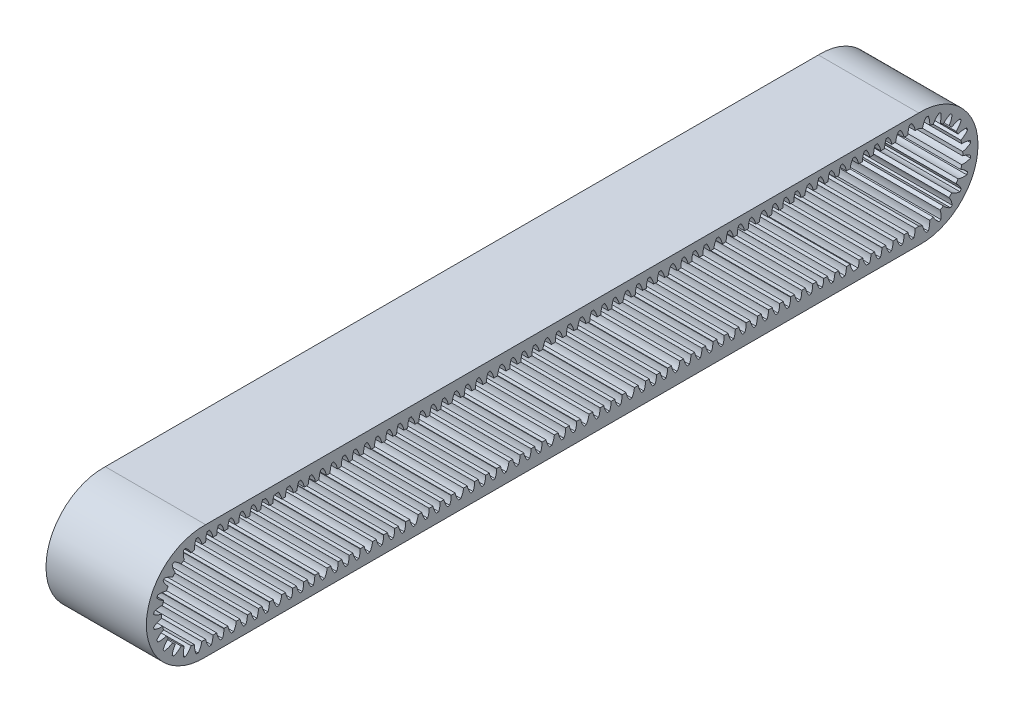
from build123d import *

# Parameters (mm, degrees)
BOSS_EXTRUDE1_DEPTH = 28


with BuildPart() as part:
    # Sketch1 → Boss-Extrude1 (new body)
    with BuildSketch(Plane(origin=(-24.036200878, 0, 0), x_dir=(0, 0, -1), z_dir=(1, 0, 0))):
        with BuildLine():
            Line((112.0321418, 33.774122943), (-86.910919226, 33.774122943))
            ThreePointArc((-86.910919226, 33.774122943), (-103.439388713, 17.782852825), (-86.910919226, 1.791582706))
            Line((-86.910919226, 1.791582706), (112.0321418, 1.791582706))
            ThreePointArc((112.0321418, 1.791582706), (128.560611287, 17.782852825), (112.0321418, 33.774122943))
        make_face()
        with BuildLine():
            Line((-87.949109181, 6.091165602), (-87.9678582, 6.044743096))
            ThreePointArc((-87.9678582, 6.044743096), (-88.331447478, 4.866089704), (-88.977199836, 3.815173496))
            ThreePointArc((-88.977199836, 3.815173496), (-89.273553099, 3.850991145), (-89.56907866, 3.893095822))
            ThreePointArc((-89.56907866, 3.893095822), (-89.92083041, 5.075335936), (-89.966972738, 6.307931518))
            ThreePointArc((-89.966972738, 6.307931518), (-90.480512493, 6.433224366), (-90.98789739, 6.581487454))
            ThreePointArc((-90.98789739, 6.581487454), (-91.64415561, 5.537099532), (-92.539901618, 4.689125434))
            ThreePointArc((-92.539901618, 4.689125434), (-92.8168866, 4.800424495), (-93.091444879, 4.917582133))
            ThreePointArc((-93.091444879, 4.917582133), (-93.125224721, 6.150578445), (-92.850775577, 7.353116864))
            ThreePointArc((-92.850775577, 7.353116864), (-93.314388713, 7.60705433), (-93.766111578, 7.881586351))
            ThreePointArc((-93.766111578, 7.881586351), (-94.670315826, 7.04263721), (-95.755011875, 6.455393256))
            ThreePointArc((-95.755011875, 6.455393256), (-95.993752506, 6.634588881), (-96.228632811, 6.818815381))
            ThreePointArc((-96.228632811, 6.818815381), (-95.942138705, 8.018541229), (-95.365801343, 9.109071479))
            ThreePointArc((-95.365801343, 9.109071479), (-95.747893392, 9.474348146), (-96.113170058, 9.856440195))
            ThreePointArc((-96.113170058, 9.856440195), (-97.203700309, 9.280102833), (-98.403426156, 8.993608727))
            ThreePointArc((-98.403426156, 8.993608727), (-98.587652657, 9.228489031), (-98.766848282, 9.467229662))
            ThreePointArc((-98.766848282, 9.467229662), (-98.179604328, 10.551925712), (-97.340655187, 11.456129959))
            ThreePointArc((-97.340655187, 11.456129959), (-97.615187208, 11.907852825), (-97.869124674, 12.371465961))
            ThreePointArc((-97.869124674, 12.371465961), (-99.059184076, 12.077032677), (-100.285089249, 12.086458648))
            ThreePointArc((-100.285089249, 12.086458648), (-100.412524375, 12.382975052), (-100.533116103, 12.682339919))
            ThreePointArc((-100.533116103, 12.682339919), (-99.685142006, 13.578085928), (-98.640754084, 14.234344147))
            ThreePointArc((-98.640754084, 14.234344147), (-98.789017172, 14.741729045), (-98.91431002, 15.255268799))
            ThreePointArc((-98.91431002, 15.255268799), (-100.146905601, 15.301411127), (-101.329145716, 15.653162878))
            ThreePointArc((-101.329145716, 15.653162878), (-101.371250393, 15.948688438), (-101.407068041, 16.245041702))
            ThreePointArc((-101.407068041, 16.245041702), (-100.356151834, 16.89079406), (-99.177498442, 17.254383337))
            ThreePointArc((-99.177498442, 17.254383337), (-99.189388713, 17.782852825), (-99.177498442, 18.311322312))
            ThreePointArc((-99.177498442, 18.311322312), (-100.356151834, 18.67491159), (-101.407068041, 19.320663947))
            ThreePointArc((-101.407068041, 19.320663947), (-101.371250393, 19.617017211), (-101.329145716, 19.912542771))
            ThreePointArc((-101.329145716, 19.912542771), (-100.146905601, 20.264294522), (-98.91431002, 20.31043685))
            ThreePointArc((-98.91431002, 20.31043685), (-98.789017172, 20.823976604), (-98.640754084, 21.331361502))
            ThreePointArc((-98.640754084, 21.331361502), (-99.685142006, 21.987619721), (-100.533116103, 22.88336573))
            ThreePointArc((-100.533116103, 22.88336573), (-100.421817043, 23.160350711), (-100.304659404, 23.43490899))
            ThreePointArc((-100.304659404, 23.43490899), (-99.071663093, 23.468688833), (-97.869124674, 23.194239688))
            ThreePointArc((-97.869124674, 23.194239688), (-97.615187208, 23.657852825), (-97.340655187, 24.10957569))
            ThreePointArc((-97.340655187, 24.10957569), (-98.179604328, 25.013779937), (-98.766848282, 26.098475987))
            ThreePointArc((-98.766848282, 26.098475987), (-98.587652657, 26.337216618), (-98.403426156, 26.572096922))
            ThreePointArc((-98.403426156, 26.572096922), (-97.203700309, 26.285602816), (-96.113170058, 25.709265454))
            ThreePointArc((-96.113170058, 25.709265454), (-95.747893392, 26.091357503), (-95.365801343, 26.45663417))
            ThreePointArc((-95.365801343, 26.45663417), (-95.942138705, 27.54716442), (-96.228632811, 28.746890268))
            ThreePointArc((-96.228632811, 28.746890268), (-95.993752506, 28.931116768), (-95.755011875, 29.110312393))
            ThreePointArc((-95.755011875, 29.110312393), (-94.670315826, 28.523068439), (-93.766111578, 27.684119298))
            ThreePointArc((-93.766111578, 27.684119298), (-93.314388713, 27.958651319), (-92.850775577, 28.212588785))
            ThreePointArc((-92.850775577, 28.212588785), (-93.125224721, 29.415127204), (-93.091444879, 30.648123516))
            ThreePointArc((-93.091444879, 30.648123516), (-92.8168866, 30.765281154), (-92.539901618, 30.876580215))
            ThreePointArc((-92.539901618, 30.876580215), (-91.64415561, 30.028606117), (-90.98789739, 28.984218195))
            ThreePointArc((-90.98789739, 28.984218195), (-90.480512493, 29.132481283), (-89.966972738, 29.257774131))
            ThreePointArc((-89.966972738, 29.257774131), (-89.92083041, 30.490369713), (-89.56907866, 31.672609827))
            ThreePointArc((-89.56907866, 31.672609827), (-89.273553099, 31.714714504), (-88.977199836, 31.750532153))
            ThreePointArc((-88.977199836, 31.750532153), (-88.331447478, 30.699615945), (-87.9678582, 29.520962553))
            ThreePointArc((-87.9678582, 29.520962553), (-87.439388713, 29.532852825), (-86.910919226, 29.520962553))
            Line((-86.910919226, 29.520962553), (-86.876378041, 29.692733051))
            ThreePointArc((-86.876378041, 29.692733051), (-86.790815157, 30.791942854), (-86.462244664, 31.844380325))
            ThreePointArc((-86.462244664, 31.844380325), (-86.166719103, 31.886485002), (-85.870365839, 31.92230265))
            ThreePointArc((-85.870365839, 31.92230265), (-85.224613482, 30.871386443), (-84.861024204, 29.692733051))
            ThreePointArc((-84.861024204, 29.692733051), (-84.334939006, 29.70462308), (-83.808849026, 29.692946556))
            ThreePointArc((-83.808849026, 29.692946556), (-83.718252314, 30.771866452), (-83.393490616, 31.80472934))
            ThreePointArc((-83.393490616, 31.80472934), (-83.097965055, 31.846834018), (-82.801611791, 31.882651666))
            ThreePointArc((-82.801611791, 31.882651666), (-82.155859434, 30.831735458), (-81.792270156, 29.653082066))
            ThreePointArc((-81.792270156, 29.653082066), (-81.263800669, 29.664972338), (-80.735331182, 29.653082066))
            Line((-80.735331182, 29.653082066), (-80.692065816, 29.634588536))
            ThreePointArc((-80.692065816, 29.634588536), (-80.606502932, 30.733798339), (-80.277932439, 31.78623581))
            ThreePointArc((-80.277932439, 31.78623581), (-79.982406879, 31.828340487), (-79.686053615, 31.864158136))
            ThreePointArc((-79.686053615, 31.864158136), (-79.040301257, 30.813241928), (-78.676711979, 29.634588536))
            ThreePointArc((-78.676711979, 29.634588536), (-78.148242492, 29.646478808), (-77.619773005, 29.634588536))
            Line((-77.619773005, 29.634588536), (-77.610895308, 29.679121052))
            ThreePointArc((-77.610895308, 29.679121052), (-77.525332424, 30.778330855), (-77.196761931, 31.830768326))
            ThreePointArc((-77.196761931, 31.830768326), (-76.90123637, 31.872873003), (-76.604883106, 31.908690651))
            ThreePointArc((-76.604883106, 31.908690651), (-75.959130749, 30.857774444), (-75.595541471, 29.679121052))
            ThreePointArc((-75.595541471, 29.679121052), (-75.067071984, 29.691011323), (-74.538602497, 29.679121052))
            Line((-74.538602497, 29.679121052), (-74.495329565, 29.705622917))
            ThreePointArc((-74.495329565, 29.705622917), (-74.409766681, 30.804832721), (-74.081196188, 31.857270191))
            ThreePointArc((-74.081196188, 31.857270191), (-73.785670628, 31.899374869), (-73.489317364, 31.935192517))
            ThreePointArc((-73.489317364, 31.935192517), (-72.843565006, 30.88427631), (-72.479975728, 29.705622917))
            ThreePointArc((-72.479975728, 29.705622917), (-71.96239113, 29.717508147), (-71.444785399, 29.706581891))
            ThreePointArc((-71.444785399, 29.706581891), (-71.355398935, 30.790473298), (-71.029697081, 31.828128744))
            Line((-71.029697081, 31.828128744), (-70.185469376, 31.754337378))
            ThreePointArc((-70.185469376, 31.754337378), (-69.539717018, 30.70342117), (-69.17612774, 29.524767778))
            ThreePointArc((-69.17612774, 29.524767778), (-68.665859283, 29.536643953), (-68.155556482, 29.526348669))
            ThreePointArc((-68.155556482, 29.526348669), (-68.085556233, 30.423267763), (-67.853149848, 31.292377174))
            ThreePointArc((-67.853149848, 31.292377174), (-67.24472064, 31.398313694), (-66.632204399, 31.47725988))
            ThreePointArc((-66.632204399, 31.47725988), (-66.025631381, 30.457420414), (-65.681311431, 29.321882156))
            ThreePointArc((-65.681311431, 29.321882156), (-65.152841944, 29.333772428), (-64.624372457, 29.321882156))
            Line((-64.624372457, 29.321882156), (-64.623645867, 29.322608746))
            ThreePointArc((-64.623645867, 29.322608746), (-64.526912338, 30.356089131), (-64.215171005, 31.346168131))
            ThreePointArc((-64.215171005, 31.346168131), (-63.832714605, 31.4043435), (-63.448801714, 31.451968745))
            ThreePointArc((-63.448801714, 31.451968745), (-62.803049357, 30.401052538), (-62.439460079, 29.222399145))
            ThreePointArc((-62.439460079, 29.222399145), (-61.911473801, 29.234289407), (-61.383486547, 29.222442571))
            ThreePointArc((-61.383486547, 29.222442571), (-61.277926134, 30.233819879), (-60.96638275, 31.201790838))
            ThreePointArc((-60.96638275, 31.201790838), (-60.670857189, 31.243895516), (-60.374503925, 31.279713164))
            ThreePointArc((-60.374503925, 31.279713164), (-59.728751568, 30.228796957), (-59.36516229, 29.050143564))
            ThreePointArc((-59.36516229, 29.050143564), (-58.836692803, 29.062033836), (-58.308223316, 29.050143564))
            Line((-58.308223316, 29.050143564), (-58.292562735, 29.065804145))
            ThreePointArc((-58.292562735, 29.065804145), (-58.17883617, 30.033824792), (-57.876217037, 30.960334028))
            ThreePointArc((-57.876217037, 30.960334028), (-57.580691476, 31.002438705), (-57.284338213, 31.038256353))
            ThreePointArc((-57.284338213, 31.038256353), (-56.638585855, 29.987340146), (-56.274996577, 28.808686754))
            ThreePointArc((-56.274996577, 28.808686754), (-55.74652709, 28.820577025), (-55.218057603, 28.808686754))
            Line((-55.218057603, 28.808686754), (-55.227747269, 28.820877099))
            ThreePointArc((-55.227747269, 28.820877099), (-55.142184385, 29.920086902), (-54.813613892, 30.972524373))
            ThreePointArc((-54.813613892, 30.972524373), (-54.518088332, 31.01462905), (-54.221735068, 31.050446699))
            ThreePointArc((-54.221735068, 31.050446699), (-53.575982711, 29.999530491), (-53.212393433, 28.820877099))
            ThreePointArc((-53.212393433, 28.820877099), (-52.683923946, 28.83276737), (-52.155454458, 28.820877099))
            Line((-52.155454458, 28.820877099), (-52.163782419, 28.858116727))
            ThreePointArc((-52.163782419, 28.858116727), (-52.078219536, 29.95732653), (-51.749649042, 31.009764001))
            ThreePointArc((-51.749649042, 31.009764001), (-51.454123482, 31.051868678), (-51.157770218, 31.087686327))
            ThreePointArc((-51.157770218, 31.087686327), (-50.512017861, 30.036770119), (-50.148428583, 28.858116727))
            ThreePointArc((-50.148428583, 28.858116727), (-49.619959096, 28.870006998), (-49.091489609, 28.858116727))
            Line((-49.091489609, 28.858116727), (-49.042850018, 28.946552333))
            ThreePointArc((-49.042850018, 28.946552333), (-48.957287134, 30.045762136), (-48.628716641, 31.098199607))
            ThreePointArc((-48.628716641, 31.098199607), (-48.33319108, 31.140304284), (-48.036837816, 31.176121933))
            ThreePointArc((-48.036837816, 31.176121933), (-47.391085459, 30.125205725), (-47.027496181, 28.946552333))
            ThreePointArc((-47.027496181, 28.946552333), (-46.501410983, 28.958442363), (-45.975321003, 28.946765839))
            ThreePointArc((-45.975321003, 28.946765839), (-45.884724291, 30.025685735), (-45.559962593, 31.058548623))
            ThreePointArc((-45.559962593, 31.058548623), (-45.264437032, 31.1006533), (-44.968083769, 31.136470948))
            ThreePointArc((-44.968083769, 31.136470948), (-44.322331411, 30.085554741), (-43.958742133, 28.906901349))
            ThreePointArc((-43.958742133, 28.906901349), (-43.430272646, 28.91879162), (-42.901803159, 28.906901349))
            Line((-42.901803159, 28.906901349), (-42.858537793, 28.888407819))
            ThreePointArc((-42.858537793, 28.888407819), (-42.77297491, 29.987617622), (-42.444404416, 31.040055093))
            ThreePointArc((-42.444404416, 31.040055093), (-42.148878856, 31.08215977), (-41.852525592, 31.117977418))
            ThreePointArc((-41.852525592, 31.117977418), (-41.206773235, 30.067061211), (-40.843183957, 28.888407819))
            ThreePointArc((-40.843183957, 28.888407819), (-40.31471447, 28.90029809), (-39.786244983, 28.888407819))
            Line((-39.786244983, 28.888407819), (-39.777367285, 28.932940334))
            ThreePointArc((-39.777367285, 28.932940334), (-39.691804401, 30.032150137), (-39.363233908, 31.084587608))
            ThreePointArc((-39.363233908, 31.084587608), (-39.067708347, 31.126692285), (-38.771355083, 31.162509934))
            ThreePointArc((-38.771355083, 31.162509934), (-38.125602726, 30.111593726), (-37.762013448, 28.932940334))
            ThreePointArc((-37.762013448, 28.932940334), (-37.233543961, 28.944830605), (-36.705074474, 28.932940334))
            Line((-36.705074474, 28.932940334), (-36.661801542, 28.9594422))
            ThreePointArc((-36.661801542, 28.9594422), (-36.576238659, 30.058652003), (-36.247668165, 31.111089474))
            ThreePointArc((-36.247668165, 31.111089474), (-35.952142605, 31.153194151), (-35.655789341, 31.189011799))
            ThreePointArc((-35.655789341, 31.189011799), (-35.010036984, 30.138095592), (-34.646447706, 28.9594422))
            ThreePointArc((-34.646447706, 28.9594422), (-34.128863107, 28.97132743), (-33.611257376, 28.960401173))
            ThreePointArc((-33.611257376, 28.960401173), (-33.521870912, 30.04429258), (-33.196169059, 31.081948026))
            ThreePointArc((-33.196169059, 31.081948026), (-32.900643498, 31.124052704), (-32.604290234, 31.159870352))
            ThreePointArc((-32.604290234, 31.159870352), (-31.958537877, 30.108954144), (-31.594948599, 28.930300752))
            ThreePointArc((-31.594948599, 28.930300752), (-31.066479112, 28.942191024), (-30.538009625, 28.930300752))
            Line((-30.538009625, 28.930300752), (-30.528051724, 28.935766688))
            ThreePointArc((-30.528051724, 28.935766688), (-30.442488841, 30.034976491), (-30.113918347, 31.087413962))
            ThreePointArc((-30.113918347, 31.087413962), (-29.818392787, 31.129518639), (-29.522039523, 31.165336287))
            Line((-29.522039523, 31.165336287), (-29.487212006, 31.048087044))
            ThreePointArc((-29.487212006, 31.048087044), (-28.841459649, 29.997170837), (-28.477870371, 28.818517444))
            ThreePointArc((-28.477870371, 28.818517444), (-27.949400884, 28.830407716), (-27.420931397, 28.818517444))
            Line((-27.420931397, 28.818517444), (-27.369310081, 28.883335483))
            ThreePointArc((-27.369310081, 28.883335483), (-27.283747197, 29.982545287), (-26.955176704, 31.034982758))
            ThreePointArc((-26.955176704, 31.034982758), (-26.659651144, 31.077087435), (-26.36329788, 31.112905083))
            ThreePointArc((-26.36329788, 31.112905083), (-25.717545522, 30.061988876), (-25.353956244, 28.883335483))
            ThreePointArc((-25.353956244, 28.883335483), (-24.825486757, 28.895225755), (-24.29701727, 28.883335483))
            Line((-24.29701727, 28.883335483), (-24.295310914, 28.881424942))
            ThreePointArc((-24.295310914, 28.881424942), (-24.20974803, 29.980634745), (-23.881177537, 31.033072216))
            ThreePointArc((-23.881177537, 31.033072216), (-23.585651976, 31.075176893), (-23.289298712, 31.110994542))
            ThreePointArc((-23.289298712, 31.110994542), (-22.643546355, 30.060078334), (-22.279957077, 28.881424942))
            ThreePointArc((-22.279957077, 28.881424942), (-21.75148759, 28.893315213), (-21.223018103, 28.881424942))
            Line((-21.223018103, 28.881424942), (-21.214586574, 28.891167214))
            ThreePointArc((-21.214586574, 28.891167214), (-21.12902369, 29.990377017), (-20.800453197, 31.042814488))
            ThreePointArc((-20.800453197, 31.042814488), (-20.504927636, 31.084919165), (-20.208574372, 31.120736813))
            ThreePointArc((-20.208574372, 31.120736813), (-19.562822015, 30.069820606), (-19.199232737, 28.891167214))
            ThreePointArc((-19.199232737, 28.891167214), (-18.67076325, 28.903057485), (-18.142293763, 28.891167214))
            Line((-18.142293763, 28.891167214), (-18.147642105, 28.893455373))
            ThreePointArc((-18.147642105, 28.893455373), (-17.90226074, 30.01294439), (-17.404147292, 31.045102647))
            ThreePointArc((-17.404147292, 31.045102647), (-17.108621731, 31.087207324), (-16.812268467, 31.123024973))
            ThreePointArc((-16.812268467, 31.123024973), (-16.16651611, 30.072108765), (-15.802926832, 28.893455373))
            ThreePointArc((-15.802926832, 28.893455373), (-15.274457345, 28.905345644), (-14.745987858, 28.893455373))
            Line((-14.745987858, 28.893455373), (-14.694366542, 28.958273412))
            ThreePointArc((-14.694366542, 28.958273412), (-14.608803658, 30.057483215), (-14.280233165, 31.109920686))
            ThreePointArc((-14.280233165, 31.109920686), (-13.984707605, 31.152025363), (-13.688354341, 31.187843012))
            ThreePointArc((-13.688354341, 31.187843012), (-13.042601983, 30.136926804), (-12.679012706, 28.958273412))
            ThreePointArc((-12.679012706, 28.958273412), (-12.150543218, 28.970163683), (-11.622073731, 28.958273412))
            Line((-11.622073731, 28.958273412), (-11.620367375, 28.956362871))
            ThreePointArc((-11.620367375, 28.956362871), (-11.534804491, 30.055572674), (-11.206233998, 31.108010145))
            ThreePointArc((-11.206233998, 31.108010145), (-10.910708437, 31.150114822), (-10.614355173, 31.18593247))
            ThreePointArc((-10.614355173, 31.18593247), (-9.968602816, 30.135016263), (-9.605013538, 28.956362871))
            ThreePointArc((-9.605013538, 28.956362871), (-9.076544051, 28.968253142), (-8.548074564, 28.956362871))
            Line((-8.548074564, 28.956362871), (-8.545871857, 28.996265589))
            ThreePointArc((-8.545871857, 28.996265589), (-8.460308973, 30.095475393), (-8.13173848, 31.147912863))
            ThreePointArc((-8.13173848, 31.147912863), (-7.83621292, 31.190017541), (-7.539859656, 31.225835189))
            ThreePointArc((-7.539859656, 31.225835189), (-6.894107298, 30.174918982), (-6.53051802, 28.996265589))
            ThreePointArc((-6.53051802, 28.996265589), (-6.002048533, 29.008155861), (-5.473579046, 28.996265589))
            Line((-5.473579046, 28.996265589), (-5.478927389, 28.998553748))
            ThreePointArc((-5.478927389, 28.998553748), (-5.233546024, 30.118042766), (-4.735432575, 31.150201022))
            ThreePointArc((-4.735432575, 31.150201022), (-4.439907015, 31.1923057), (-4.143553751, 31.228123348))
            ThreePointArc((-4.143553751, 31.228123348), (-3.497801394, 30.177207141), (-3.134212116, 28.998553748))
            ThreePointArc((-3.134212116, 28.998553748), (-2.605742629, 29.01044402), (-2.077273142, 28.998553748))
            Line((-2.077273142, 28.998553748), (-2.025651826, 29.063371787))
            ThreePointArc((-2.025651826, 29.063371787), (-1.940088942, 30.162581591), (-1.611518449, 31.215019061))
            ThreePointArc((-1.611518449, 31.215019061), (-1.315992888, 31.257123739), (-1.019639625, 31.292941387))
            ThreePointArc((-1.019639625, 31.292941387), (-0.373887267, 30.24202518), (-0.010297989, 29.063371787))
            ThreePointArc((-0.010297989, 29.063371787), (0.518171498, 29.075262059), (1.046640985, 29.063371787))
            Line((1.046640985, 29.063371787), (1.048347342, 29.061461246))
            ThreePointArc((1.048347342, 29.061461246), (1.133910226, 30.160671049), (1.462480719, 31.21310852))
            ThreePointArc((1.462480719, 31.21310852), (1.758006279, 31.255213197), (2.054359543, 31.291030846))
            ThreePointArc((2.054359543, 31.291030846), (2.700111901, 30.240114638), (3.063701179, 29.061461246))
            ThreePointArc((3.063701179, 29.061461246), (3.592170666, 29.073351517), (4.120640153, 29.061461246))
            Line((4.120640153, 29.061461246), (4.129071682, 29.071203518))
            ThreePointArc((4.129071682, 29.071203518), (4.214634566, 30.170413321), (4.543205059, 31.222850792))
            ThreePointArc((4.543205059, 31.222850792), (4.838730619, 31.264955469), (5.135083883, 31.300773117))
            ThreePointArc((5.135083883, 31.300773117), (5.780836241, 30.24985691), (6.144425519, 29.071203518))
            ThreePointArc((6.144425519, 29.071203518), (6.672895006, 29.083093789), (7.201364493, 29.071203518))
            Line((7.201364493, 29.071203518), (7.19601615, 29.073491677))
            ThreePointArc((7.19601615, 29.073491677), (7.441397515, 30.192980694), (7.939510964, 31.225138951))
            ThreePointArc((7.939510964, 31.225138951), (8.235036524, 31.267243628), (8.531389788, 31.303061277))
            ThreePointArc((8.531389788, 31.303061277), (9.177142145, 30.252145069), (9.540731423, 29.073491677))
            ThreePointArc((9.540731423, 29.073491677), (10.06920091, 29.085381948), (10.597670397, 29.073491677))
            Line((10.597670397, 29.073491677), (10.649291713, 29.138309716))
            ThreePointArc((10.649291713, 29.138309716), (10.734854597, 30.237519519), (11.06342509, 31.28995699))
            ThreePointArc((11.06342509, 31.28995699), (11.358950651, 31.332061667), (11.655303914, 31.367879316))
            ThreePointArc((11.655303914, 31.367879316), (12.301056272, 30.316963108), (12.66464555, 29.138309716))
            ThreePointArc((12.66464555, 29.138309716), (13.193115037, 29.150199987), (13.721584524, 29.138309716))
            Line((13.721584524, 29.138309716), (13.723290881, 29.136399175))
            ThreePointArc((13.723290881, 29.136399175), (13.808853765, 30.235608978), (14.137424258, 31.288046449))
            Line((14.137424258, 31.288046449), (14.196260855, 31.411396439))
            ThreePointArc((14.196260855, 31.411396439), (14.491786416, 31.453501117), (14.788139679, 31.489318765))
            ThreePointArc((14.788139679, 31.489318765), (15.433892037, 30.438402557), (15.797481315, 29.259749165))
            ThreePointArc((15.797481315, 29.259749165), (16.325950802, 29.271639437), (16.854420289, 29.259749165))
            Line((16.854420289, 29.259749165), (16.849071946, 29.262037324))
            ThreePointArc((16.849071946, 29.262037324), (17.094453312, 30.381526342), (17.59256676, 31.413684598))
            ThreePointArc((17.59256676, 31.413684598), (17.88809232, 31.455789276), (18.184445584, 31.491606924))
            ThreePointArc((18.184445584, 31.491606924), (18.830197942, 30.440690717), (19.19378722, 29.262037324))
            ThreePointArc((19.19378722, 29.262037324), (19.722256707, 29.273927596), (20.250726194, 29.262037324))
            Line((20.250726194, 29.262037324), (20.302347509, 29.326855363))
            ThreePointArc((20.302347509, 29.326855363), (20.387910393, 30.426065167), (20.716480886, 31.478502637))
            ThreePointArc((20.716480886, 31.478502637), (21.012006447, 31.520607315), (21.308359711, 31.556424963))
            ThreePointArc((21.308359711, 31.556424963), (21.954112068, 30.505508756), (22.317701346, 29.326855363))
            ThreePointArc((22.317701346, 29.326855363), (22.846170833, 29.338745635), (23.37464032, 29.326855363))
            Line((23.37464032, 29.326855363), (23.376346677, 29.324944822))
            ThreePointArc((23.376346677, 29.324944822), (23.461909561, 30.424154625), (23.790480054, 31.476592096))
            ThreePointArc((23.790480054, 31.476592096), (24.086005614, 31.518696773), (24.382358878, 31.554514422))
            ThreePointArc((24.382358878, 31.554514422), (25.028111236, 30.503598214), (25.391700514, 29.324944822))
            ThreePointArc((25.391700514, 29.324944822), (25.920170001, 29.336835093), (26.448639488, 29.324944822))
            Line((26.448639488, 29.324944822), (26.457071017, 29.334687094))
            ThreePointArc((26.457071017, 29.334687094), (26.542633901, 30.433896897), (26.871204394, 31.486334368))
            ThreePointArc((26.871204394, 31.486334368), (27.166729954, 31.528439045), (27.463083218, 31.564256693))
            ThreePointArc((27.463083218, 31.564256693), (28.108835576, 30.513340486), (28.472424854, 29.334687094))
            ThreePointArc((28.472424854, 29.334687094), (29.000894341, 29.346577365), (29.529363828, 29.334687094))
            Line((29.529363828, 29.334687094), (29.524015485, 29.336975253))
            ThreePointArc((29.524015485, 29.336975253), (29.76939685, 30.45646427), (30.267510299, 31.488622527))
            ThreePointArc((30.267510299, 31.488622527), (30.563035859, 31.530727204), (30.859389123, 31.566544853))
            ThreePointArc((30.859389123, 31.566544853), (31.505141481, 30.515628645), (31.868730758, 29.336975253))
            ThreePointArc((31.868730758, 29.336975253), (32.397200246, 29.348865524), (32.925669733, 29.336975253))
            Line((32.925669733, 29.336975253), (32.977291048, 29.401793292))
            ThreePointArc((32.977291048, 29.401793292), (33.062853932, 30.501003095), (33.391424425, 31.553440566))
            ThreePointArc((33.391424425, 31.553440566), (33.686949986, 31.595545243), (33.98330325, 31.631362891))
            ThreePointArc((33.98330325, 31.631362891), (34.629055607, 30.580446684), (34.992644885, 29.401793292))
            ThreePointArc((34.992644885, 29.401793292), (35.521114372, 29.413683563), (36.049583859, 29.401793292))
            Line((36.049583859, 29.401793292), (36.051290216, 29.399882751))
            ThreePointArc((36.051290216, 29.399882751), (36.1368531, 30.499092554), (36.465423593, 31.551530025))
            ThreePointArc((36.465423593, 31.551530025), (36.760949153, 31.593634702), (37.057302417, 31.62945235))
            ThreePointArc((37.057302417, 31.62945235), (37.703054775, 30.578536143), (38.066644053, 29.399882751))
            ThreePointArc((38.066644053, 29.399882751), (38.59511354, 29.411773022), (39.123583027, 29.399882751))
            Line((39.123583027, 29.399882751), (39.125785733, 29.439785469))
            ThreePointArc((39.125785733, 29.439785469), (39.211348617, 30.538995273), (39.53991911, 31.591432743))
            ThreePointArc((39.53991911, 31.591432743), (39.835444671, 31.633537421), (40.131797935, 31.669355069))
            ThreePointArc((40.131797935, 31.669355069), (40.777550292, 30.618438861), (41.14113957, 29.439785469))
            ThreePointArc((41.14113957, 29.439785469), (41.669609057, 29.451675741), (42.198078544, 29.439785469))
            Line((42.198078544, 29.439785469), (42.192730201, 29.442073628))
            ThreePointArc((42.192730201, 29.442073628), (42.438111567, 30.561562646), (42.936225015, 31.593720902))
            ThreePointArc((42.936225015, 31.593720902), (43.231750576, 31.63582558), (43.528103839, 31.671643228))
            ThreePointArc((43.528103839, 31.671643228), (44.173856197, 30.620727021), (44.537445475, 29.442073628))
            ThreePointArc((44.537445475, 29.442073628), (45.065914962, 29.4539639), (45.594384449, 29.442073628))
            Line((45.594384449, 29.442073628), (45.646005764, 29.506891667))
            ThreePointArc((45.646005764, 29.506891667), (45.731568648, 30.606101471), (46.060139141, 31.658538941))
            ThreePointArc((46.060139141, 31.658538941), (46.355664702, 31.700643619), (46.652017966, 31.736461267))
            ThreePointArc((46.652017966, 31.736461267), (47.297770323, 30.68554506), (47.661359601, 29.506891667))
            ThreePointArc((47.661359601, 29.506891667), (48.189829088, 29.518781939), (48.718298575, 29.506891667))
            Line((48.718298575, 29.506891667), (48.720004932, 29.504981126))
            ThreePointArc((48.720004932, 29.504981126), (48.805567816, 30.604190929), (49.134138309, 31.6566284))
            ThreePointArc((49.134138309, 31.6566284), (49.42966387, 31.698733077), (49.726017134, 31.734550726))
            ThreePointArc((49.726017134, 31.734550726), (50.371769491, 30.683634518), (50.735358769, 29.504981126))
            ThreePointArc((50.735358769, 29.504981126), (51.263828256, 29.516871397), (51.792297743, 29.504981126))
            Line((51.792297743, 29.504981126), (51.800729272, 29.514723398))
            ThreePointArc((51.800729272, 29.514723398), (51.886292156, 30.613933201), (52.214862649, 31.666370672))
            ThreePointArc((52.214862649, 31.666370672), (52.51038821, 31.708475349), (52.806741474, 31.744292997))
            ThreePointArc((52.806741474, 31.744292997), (53.452493831, 30.69337679), (53.816083109, 29.514723398))
            ThreePointArc((53.816083109, 29.514723398), (54.344552596, 29.526613669), (54.873022083, 29.514723398))
            Line((54.873022083, 29.514723398), (54.86767374, 29.517011557))
            ThreePointArc((54.86767374, 29.517011557), (55.113055106, 30.636500574), (55.611168554, 31.668658831))
            ThreePointArc((55.611168554, 31.668658831), (55.906694115, 31.710763508), (56.203047378, 31.746581156))
            ThreePointArc((56.203047378, 31.746581156), (56.848799736, 30.695664949), (57.212389014, 29.517011557))
            ThreePointArc((57.212389014, 29.517011557), (57.740858501, 29.528901828), (58.269327988, 29.517011557))
            Line((58.269327988, 29.517011557), (58.320949303, 29.581829596))
            ThreePointArc((58.320949303, 29.581829596), (58.406512187, 30.681039399), (58.73508268, 31.73347687))
            ThreePointArc((58.73508268, 31.73347687), (59.030608241, 31.775581547), (59.326961505, 31.811399195))
            ThreePointArc((59.326961505, 31.811399195), (59.972713862, 30.760482988), (60.33630314, 29.581829596))
            ThreePointArc((60.33630314, 29.581829596), (60.864772627, 29.593719867), (61.393242114, 29.581829596))
            Line((61.393242114, 29.581829596), (61.394948471, 29.579919055))
            ThreePointArc((61.394948471, 29.579919055), (61.480511355, 30.679128858), (61.809081848, 31.731566329))
            ThreePointArc((61.809081848, 31.731566329), (62.104607409, 31.773671006), (62.400960673, 31.809488654))
            ThreePointArc((62.400960673, 31.809488654), (63.04671303, 30.758572447), (63.410302308, 29.579919055))
            ThreePointArc((63.410302308, 29.579919055), (63.938771795, 29.591809326), (64.467241282, 29.579919055))
            Line((64.467241282, 29.579919055), (64.501087972, 29.657726584))
            ThreePointArc((64.501087972, 29.657726584), (64.586650856, 30.756936387), (64.915221349, 31.809373858))
            ThreePointArc((64.915221349, 31.809373858), (65.21074691, 31.851478535), (65.507100174, 31.887296184))
            ThreePointArc((65.507100174, 31.887296184), (66.152852531, 30.836379976), (66.516441809, 29.657726584))
            ThreePointArc((66.516441809, 29.657726584), (67.044911296, 29.669616855), (67.573380783, 29.657726584))
            Line((67.573380783, 29.657726584), (67.56803244, 29.660014743))
            ThreePointArc((67.56803244, 29.660014743), (67.813413806, 30.77950376), (68.311527254, 31.811662017))
            ThreePointArc((68.311527254, 31.811662017), (68.607052815, 31.853766694), (68.903406078, 31.889584343))
            ThreePointArc((68.903406078, 31.889584343), (69.549158436, 30.838668135), (69.912747714, 29.660014743))
            ThreePointArc((69.912747714, 29.660014743), (70.441217201, 29.671905015), (70.969686688, 29.660014743))
            Line((70.969686688, 29.660014743), (71.021308003, 29.724832782))
            ThreePointArc((71.021308003, 29.724832782), (71.106870887, 30.824042585), (71.43544138, 31.876480056))
            ThreePointArc((71.43544138, 31.876480056), (71.730966941, 31.918584733), (72.027320205, 31.954402382))
            ThreePointArc((72.027320205, 31.954402382), (72.673072562, 30.903486174), (73.03666184, 29.724832782))
            ThreePointArc((73.03666184, 29.724832782), (73.565131327, 29.736723054), (74.093600814, 29.724832782))
            Line((74.093600814, 29.724832782), (74.095307171, 29.722922241))
            ThreePointArc((74.095307171, 29.722922241), (74.180870055, 30.822132044), (74.509440548, 31.874569515))
            ThreePointArc((74.509440548, 31.874569515), (74.804966109, 31.916674192), (75.101319373, 31.95249184))
            ThreePointArc((75.101319373, 31.95249184), (75.74707173, 30.901575633), (76.110661008, 29.722922241))
            ThreePointArc((76.110661008, 29.722922241), (76.639130495, 29.734812512), (77.167599982, 29.722922241))
            Line((77.167599982, 29.722922241), (77.176031511, 29.732664513))
            ThreePointArc((77.176031511, 29.732664513), (77.261594395, 30.831874316), (77.590164888, 31.884311787))
            ThreePointArc((77.590164888, 31.884311787), (77.885690449, 31.926416464), (78.182043713, 31.962234112))
            ThreePointArc((78.182043713, 31.962234112), (78.82779607, 30.911317905), (79.191385348, 29.732664513))
            ThreePointArc((79.191385348, 29.732664513), (79.719854835, 29.744554784), (80.248324322, 29.732664513))
            Line((80.248324322, 29.732664513), (80.242975979, 29.734952672))
            ThreePointArc((80.242975979, 29.734952672), (80.488357345, 30.854441689), (80.986470793, 31.886599946))
            ThreePointArc((80.986470793, 31.886599946), (81.281996354, 31.928704623), (81.578349617, 31.964522271))
            ThreePointArc((81.578349617, 31.964522271), (82.224101975, 30.913606064), (82.587691253, 29.734952672))
            ThreePointArc((82.587691253, 29.734952672), (83.11616074, 29.746842943), (83.644630227, 29.734952672))
            Line((83.644630227, 29.734952672), (83.696251542, 29.799770711))
            ThreePointArc((83.696251542, 29.799770711), (83.781814426, 30.898980514), (84.110384919, 31.951417985))
            ThreePointArc((84.110384919, 31.951417985), (84.40591048, 31.993522662), (84.702263744, 32.02934031))
            ThreePointArc((84.702263744, 32.02934031), (85.348016101, 30.978424103), (85.711605379, 29.799770711))
            ThreePointArc((85.711605379, 29.799770711), (86.240074866, 29.811660982), (86.768544353, 29.799770711))
            Line((86.768544353, 29.799770711), (86.77025071, 29.797860169))
            ThreePointArc((86.77025071, 29.797860169), (86.855813594, 30.897069973), (87.184384087, 31.949507443))
            ThreePointArc((87.184384087, 31.949507443), (87.479909648, 31.991612121), (87.776262911, 32.027429769))
            ThreePointArc((87.776262911, 32.027429769), (88.422015269, 30.976513562), (88.785604547, 29.797860169))
            ThreePointArc((88.785604547, 29.797860169), (89.314074034, 29.809750441), (89.842543521, 29.797860169))
            Line((89.842543521, 29.797860169), (89.844746227, 29.837762888))
            ThreePointArc((89.844746227, 29.837762888), (89.930309111, 30.936972691), (90.258879604, 31.989410162))
            ThreePointArc((90.258879604, 31.989410162), (90.554405165, 32.031514839), (90.850758429, 32.067332488))
            ThreePointArc((90.850758429, 32.067332488), (91.496510786, 31.01641628), (91.860100064, 29.837762888))
            ThreePointArc((91.860100064, 29.837762888), (92.388569551, 29.849653159), (92.917039038, 29.837762888))
            Line((92.917039038, 29.837762888), (92.911690696, 29.840051047))
            ThreePointArc((92.911690696, 29.840051047), (93.157072061, 30.959540064), (93.655185509, 31.991698321))
            ThreePointArc((93.655185509, 31.991698321), (93.95071107, 32.033802998), (94.247064334, 32.069620647))
            ThreePointArc((94.247064334, 32.069620647), (94.892816691, 31.018704439), (95.256405969, 29.840051047))
            ThreePointArc((95.256405969, 29.840051047), (95.784875456, 29.851941319), (96.313344943, 29.840051047))
            Line((96.313344943, 29.840051047), (96.364966259, 29.904869086))
            ThreePointArc((96.364966259, 29.904869086), (96.450529143, 31.004078889), (96.779099636, 32.05651636))
            ThreePointArc((96.779099636, 32.05651636), (97.074625196, 32.098621037), (97.37097846, 32.134438686))
            ThreePointArc((97.37097846, 32.134438686), (98.016730818, 31.083522478), (98.380320096, 29.904869086))
            ThreePointArc((98.380320096, 29.904869086), (98.908789583, 29.916759358), (99.43725907, 29.904869086))
            Line((99.43725907, 29.904869086), (99.438965426, 29.902958545))
            ThreePointArc((99.438965426, 29.902958545), (99.52452831, 31.002168348), (99.853098803, 32.054605819))
            ThreePointArc((99.853098803, 32.054605819), (100.148624364, 32.096710496), (100.444977628, 32.132528144))
            ThreePointArc((100.444977628, 32.132528144), (101.090729985, 31.081611937), (101.454319263, 29.902958545))
            ThreePointArc((101.454319263, 29.902958545), (101.98278875, 29.914848816), (102.511258237, 29.902958545))
            Line((102.511258237, 29.902958545), (102.519689766, 29.912700817))
            ThreePointArc((102.519689766, 29.912700817), (102.60525265, 31.01191062), (102.933823143, 32.064348091))
            ThreePointArc((102.933823143, 32.064348091), (103.229348704, 32.106452768), (103.525701968, 32.142270416))
            ThreePointArc((103.525701968, 32.142270416), (104.171454325, 31.091354209), (104.535043603, 29.912700817))
            ThreePointArc((104.535043603, 29.912700817), (105.06351309, 29.924591088), (105.591982577, 29.912700817))
            Line((105.591982577, 29.912700817), (105.586634235, 29.914988976))
            ThreePointArc((105.586634235, 29.914988976), (105.8320156, 31.034477993), (106.330129048, 32.06663625))
            ThreePointArc((106.330129048, 32.06663625), (106.625654609, 32.108740927), (106.922007873, 32.144558575))
            ThreePointArc((106.922007873, 32.144558575), (107.56776023, 31.093642368), (107.931349508, 29.914988976))
            ThreePointArc((107.931349508, 29.914988976), (108.459818995, 29.926879247), (108.988288482, 29.914988976))
            Line((108.988288482, 29.914988976), (109.039909798, 29.979807015))
            ThreePointArc((109.039909798, 29.979807015), (109.125472682, 31.079016818), (109.454043175, 32.131454289))
            ThreePointArc((109.454043175, 32.131454289), (109.749568735, 32.173558966), (110.045921999, 32.209376614))
            ThreePointArc((110.045921999, 32.209376614), (110.691674357, 31.158460407), (111.055263635, 29.979807015))
            ThreePointArc((111.055263635, 29.979807015), (111.583733122, 29.991697286), (112.112202609, 29.979807015))
            Line((112.112202609, 29.979807015), (113.089080774, 29.520962553))
            ThreePointArc((113.089080774, 29.520962553), (113.452670052, 30.699615945), (114.098422409, 31.750532153))
            ThreePointArc((114.098422409, 31.750532153), (114.394775673, 31.714714504), (114.690301234, 31.672609827))
            ThreePointArc((114.690301234, 31.672609827), (115.042052984, 30.490369713), (115.088195312, 29.257774131))
            ThreePointArc((115.088195312, 29.257774131), (115.601735067, 29.132481283), (116.109119964, 28.984218195))
            ThreePointArc((116.109119964, 28.984218195), (116.765378183, 30.028606117), (117.661124192, 30.876580215))
            ThreePointArc((117.661124192, 30.876580215), (117.938109174, 30.765281154), (118.212667453, 30.648123516))
            ThreePointArc((118.212667453, 30.648123516), (118.246447295, 29.415127204), (117.97199815, 28.212588785))
            ThreePointArc((117.97199815, 28.212588785), (118.435611287, 27.958651319), (118.887334152, 27.684119298))
            ThreePointArc((118.887334152, 27.684119298), (119.791538399, 28.523068439), (120.876234449, 29.110312393))
            ThreePointArc((120.876234449, 29.110312393), (121.11497508, 28.931116768), (121.349855384, 28.746890268))
            ThreePointArc((121.349855384, 28.746890268), (121.063361279, 27.54716442), (120.487023916, 26.45663417))
            ThreePointArc((120.487023916, 26.45663417), (120.869115966, 26.091357503), (121.234392632, 25.709265454))
            ThreePointArc((121.234392632, 25.709265454), (122.324922883, 26.285602816), (123.52464873, 26.572096922))
            ThreePointArc((123.52464873, 26.572096922), (123.708875231, 26.337216618), (123.888070856, 26.098475987))
            ThreePointArc((123.888070856, 26.098475987), (123.300826902, 25.013779937), (122.461877761, 24.10957569))
            ThreePointArc((122.461877761, 24.10957569), (122.736409781, 23.657852825), (122.990347248, 23.194239688))
            ThreePointArc((122.990347248, 23.194239688), (124.192885667, 23.468688833), (125.425881978, 23.43490899))
            ThreePointArc((125.425881978, 23.43490899), (125.543039617, 23.160350711), (125.654338677, 22.88336573))
            ThreePointArc((125.654338677, 22.88336573), (124.80636458, 21.987619721), (123.761976658, 21.331361502))
            ThreePointArc((123.761976658, 21.331361502), (123.910239746, 20.823976604), (124.035532594, 20.31043685))
            ThreePointArc((124.035532594, 20.31043685), (125.268128175, 20.264294522), (126.45036829, 19.912542771))
            ThreePointArc((126.45036829, 19.912542771), (126.492472967, 19.617017211), (126.528290615, 19.320663947))
            ThreePointArc((126.528290615, 19.320663947), (125.477374408, 18.67491159), (124.298721016, 18.311322312))
            ThreePointArc((124.298721016, 18.311322312), (124.310611287, 17.782852825), (124.298721016, 17.254383337))
            ThreePointArc((124.298721016, 17.254383337), (125.477374408, 16.89079406), (126.528290615, 16.245041702))
            ThreePointArc((126.528290615, 16.245041702), (126.492472967, 15.948688438), (126.45036829, 15.653162878))
            ThreePointArc((126.45036829, 15.653162878), (125.268128175, 15.301411127), (124.035532594, 15.255268799))
            ThreePointArc((124.035532594, 15.255268799), (123.910239746, 14.741729045), (123.761976658, 14.234344147))
            ThreePointArc((123.761976658, 14.234344147), (124.80636458, 13.578085928), (125.654338677, 12.682339919))
            ThreePointArc((125.654338677, 12.682339919), (125.543039617, 12.405354938), (125.425881978, 12.130796659))
            ThreePointArc((125.425881978, 12.130796659), (124.192885667, 12.097016816), (122.990347248, 12.371465961))
            ThreePointArc((122.990347248, 12.371465961), (122.736409781, 11.907852825), (122.461877761, 11.456129959))
            ThreePointArc((122.461877761, 11.456129959), (123.300826902, 10.551925712), (123.888070856, 9.467229662))
            ThreePointArc((123.888070856, 9.467229662), (123.708875231, 9.228489031), (123.52464873, 8.993608727))
            ThreePointArc((123.52464873, 8.993608727), (122.324922883, 9.280102833), (121.234392632, 9.856440195))
            ThreePointArc((121.234392632, 9.856440195), (120.869115966, 9.474348146), (120.487023916, 9.109071479))
            ThreePointArc((120.487023916, 9.109071479), (121.063361279, 8.018541229), (121.349855384, 6.818815381))
            ThreePointArc((121.349855384, 6.818815381), (121.11497508, 6.634588881), (120.876234449, 6.455393256))
            ThreePointArc((120.876234449, 6.455393256), (119.791538399, 7.04263721), (118.887334152, 7.881586351))
            ThreePointArc((118.887334152, 7.881586351), (118.435611287, 7.60705433), (117.97199815, 7.353116864))
            ThreePointArc((117.97199815, 7.353116864), (118.246447295, 6.150578445), (118.212667453, 4.917582133))
            ThreePointArc((118.212667453, 4.917582133), (117.938109174, 4.800424495), (117.661124192, 4.689125434))
            ThreePointArc((117.661124192, 4.689125434), (116.765378183, 5.537099532), (116.109119964, 6.581487454))
            ThreePointArc((116.109119964, 6.581487454), (115.601735067, 6.433224366), (115.088195312, 6.307931518))
            ThreePointArc((115.088195312, 6.307931518), (115.042052984, 5.075335936), (114.690301234, 3.893095822))
            ThreePointArc((114.690301234, 3.893095822), (114.394775673, 3.850991145), (114.098422409, 3.815173496))
            ThreePointArc((114.098422409, 3.815173496), (113.452670052, 4.866089704), (113.089080774, 6.044743096))
            Line((113.089080774, 6.044743096), (112.098116799, 6.376329024))
            ThreePointArc((112.098116799, 6.376329024), (111.572031606, 6.364438995), (111.04594163, 6.376115518))
            ThreePointArc((111.04594163, 6.376115518), (110.955344918, 5.297195622), (110.63058322, 4.264332734))
            ThreePointArc((110.63058322, 4.264332734), (110.335057659, 4.222228057), (110.038704396, 4.186410409))
            ThreePointArc((110.038704396, 4.186410409), (109.392952034, 5.237326615), (109.029362751, 6.415980008))
            ThreePointArc((109.029362751, 6.415980008), (108.500893264, 6.404089737), (107.972423777, 6.415980009))
            Line((107.972423777, 6.415980009), (107.929158412, 6.434473539))
            ThreePointArc((107.929158412, 6.434473539), (107.843595528, 5.335263735), (107.515025035, 4.282826265))
            ThreePointArc((107.515025035, 4.282826265), (107.219499474, 4.240721587), (106.92314621, 4.204903939))
            ThreePointArc((106.92314621, 4.204903939), (106.277393853, 5.255820146), (105.913804575, 6.434473539))
            ThreePointArc((105.913804575, 6.434473539), (105.385335088, 6.422583267), (104.856865601, 6.434473539))
            Line((104.856865601, 6.434473539), (104.847987903, 6.389941023))
            ThreePointArc((104.847987903, 6.389941023), (104.762425019, 5.29073122), (104.433854526, 4.238293749))
            ThreePointArc((104.433854526, 4.238293749), (104.138328965, 4.196189072), (103.841975701, 4.160371424))
            ThreePointArc((103.841975701, 4.160371424), (103.196223344, 5.211287631), (102.832634066, 6.389941023))
            ThreePointArc((102.832634066, 6.389941023), (102.304164579, 6.378050752), (101.775695092, 6.389941023))
            Line((101.775695092, 6.389941023), (101.732422161, 6.363439158))
            ThreePointArc((101.732422161, 6.363439158), (101.646859277, 5.264229354), (101.318288784, 4.211791883))
            ThreePointArc((101.318288784, 4.211791883), (101.022763223, 4.169687206), (100.726409959, 4.133869558))
            ThreePointArc((100.726409959, 4.133869558), (100.080657602, 5.184785765), (99.717068324, 6.363439158))
            ThreePointArc((99.717068324, 6.363439158), (99.199483725, 6.351553928), (98.681877995, 6.362480184))
            ThreePointArc((98.681877995, 6.362480184), (98.59249153, 5.278588777), (98.266789677, 4.240933331))
            Line((98.266789677, 4.240933331), (97.422561971, 4.314724697))
            ThreePointArc((97.422561971, 4.314724697), (96.776809614, 5.365640905), (96.413220336, 6.544294297))
            ThreePointArc((96.413220336, 6.544294297), (95.902951879, 6.532418122), (95.392649078, 6.542713406))
            ThreePointArc((95.392649078, 6.542713406), (95.322648828, 5.645794312), (95.090242443, 4.776684901))
            ThreePointArc((95.090242443, 4.776684901), (94.481813236, 4.670748381), (93.869296994, 4.591802194))
            ThreePointArc((93.869296994, 4.591802194), (93.262723976, 5.611641661), (92.918404026, 6.747179918))
            ThreePointArc((92.918404026, 6.747179918), (92.389934539, 6.735289647), (91.861465052, 6.747179918))
            Line((91.861465052, 6.747179918), (91.860738463, 6.746453329))
            ThreePointArc((91.860738463, 6.746453329), (91.764004933, 5.712972943), (91.452263601, 4.722893944))
            ThreePointArc((91.452263601, 4.722893944), (91.0698072, 4.664718575), (90.68589431, 4.61709333))
            ThreePointArc((90.68589431, 4.61709333), (90.040141952, 5.668009537), (89.676552674, 6.846662929))
            ThreePointArc((89.676552674, 6.846662929), (89.148566397, 6.834772668), (88.620579143, 6.846619503))
            ThreePointArc((88.620579143, 6.846619503), (88.515018729, 5.835242196), (88.203475345, 4.867271236))
            ThreePointArc((88.203475345, 4.867271236), (87.907949785, 4.825166559), (87.611596521, 4.789348911))
            ThreePointArc((87.611596521, 4.789348911), (86.965844163, 5.840265118), (86.602254885, 7.018918511))
            ThreePointArc((86.602254885, 7.018918511), (86.073785398, 7.007028239), (85.545315911, 7.018918511))
            Line((85.545315911, 7.018918511), (85.529655331, 7.00325793))
            ThreePointArc((85.529655331, 7.00325793), (85.415928765, 6.035237283), (85.113309632, 5.108728047))
            ThreePointArc((85.113309632, 5.108728047), (84.817784072, 5.06662337), (84.521430808, 5.030805722))
            ThreePointArc((84.521430808, 5.030805722), (83.87567845, 6.081721929), (83.512089173, 7.260375321))
            ThreePointArc((83.512089173, 7.260375321), (82.983619686, 7.24848505), (82.455150198, 7.260375321))
            Line((82.455150198, 7.260375321), (82.464839865, 7.248184976))
            ThreePointArc((82.464839865, 7.248184976), (82.379276981, 6.148975172), (82.050706488, 5.096537702))
            ThreePointArc((82.050706488, 5.096537702), (81.755180927, 5.054433024), (81.458827663, 5.018615376))
            ThreePointArc((81.458827663, 5.018615376), (80.813075306, 6.069531584), (80.449486028, 7.248184976))
            ThreePointArc((80.449486028, 7.248184976), (79.921016541, 7.236294704), (79.392547054, 7.248184976))
            Line((79.392547054, 7.248184976), (79.400875015, 7.210945348))
            ThreePointArc((79.400875015, 7.210945348), (79.315312131, 6.111735545), (78.986741638, 5.059298074))
            ThreePointArc((78.986741638, 5.059298074), (78.691216077, 5.017193397), (78.394862813, 4.981375748))
            ThreePointArc((78.394862813, 4.981375748), (77.749110456, 6.032291956), (77.385521178, 7.210945348))
            ThreePointArc((77.385521178, 7.210945348), (76.857051691, 7.199055077), (76.328582204, 7.210945348))
            Line((76.328582204, 7.210945348), (76.279942613, 7.122509742))
            ThreePointArc((76.279942613, 7.122509742), (76.194379729, 6.023299938), (75.865809236, 4.970862468))
            ThreePointArc((75.865809236, 4.970862468), (75.570283676, 4.92875779), (75.273930412, 4.892940142))
            ThreePointArc((75.273930412, 4.892940142), (74.628178054, 5.943856349), (74.264588776, 7.122509742))
            ThreePointArc((74.264588776, 7.122509742), (73.738503579, 7.110619712), (73.212413599, 7.122296236))
            ThreePointArc((73.212413599, 7.122296236), (73.121816887, 6.04337634), (72.797055189, 5.010513452))
            ThreePointArc((72.797055189, 5.010513452), (72.501529628, 4.968408775), (72.205176364, 4.932591126))
            ThreePointArc((72.205176364, 4.932591126), (71.559424007, 5.983507334), (71.195834729, 7.162160726))
            ThreePointArc((71.195834729, 7.162160726), (70.667365242, 7.150270455), (70.138895755, 7.162160726))
            Line((70.138895755, 7.162160726), (70.095630389, 7.180654256))
            ThreePointArc((70.095630389, 7.180654256), (70.010067505, 6.081444453), (69.681497012, 5.029006982))
            ThreePointArc((69.681497012, 5.029006982), (69.385971451, 4.986902305), (69.089618187, 4.951084657))
            ThreePointArc((69.089618187, 4.951084657), (68.44386583, 6.002000864), (68.080276552, 7.180654256))
            ThreePointArc((68.080276552, 7.180654256), (67.551807065, 7.168763985), (67.023337578, 7.180654256))
            Line((67.023337578, 7.180654256), (67.01445988, 7.136121741))
            ThreePointArc((67.01445988, 7.136121741), (66.928896996, 6.036911938), (66.600326503, 4.984474467))
            ThreePointArc((66.600326503, 4.984474467), (66.304800942, 4.94236979), (66.008447679, 4.906552141))
            ThreePointArc((66.008447679, 4.906552141), (65.362695321, 5.957468349), (64.999106043, 7.136121741))
            ThreePointArc((64.999106043, 7.136121741), (64.470636556, 7.124231469), (63.942167069, 7.136121741))
            Line((63.942167069, 7.136121741), (63.898894138, 7.109619875))
            ThreePointArc((63.898894138, 7.109619875), (63.813331254, 6.010410072), (63.484760761, 4.957972601))
            ThreePointArc((63.484760761, 4.957972601), (63.1892352, 4.915867924), (62.892881936, 4.880050275))
            ThreePointArc((62.892881936, 4.880050275), (62.247129579, 5.930966483), (61.883540301, 7.109619875))
            ThreePointArc((61.883540301, 7.109619875), (61.365955702, 7.097734645), (60.848349972, 7.108660902))
            ThreePointArc((60.848349972, 7.108660902), (60.758963508, 6.024769495), (60.433261654, 4.987114049))
            ThreePointArc((60.433261654, 4.987114049), (60.137736093, 4.945009371), (59.841382829, 4.909191723))
            ThreePointArc((59.841382829, 4.909191723), (59.195630472, 5.96010793), (58.832041194, 7.138761323))
            ThreePointArc((58.832041194, 7.138761323), (58.303571707, 7.126871051), (57.77510222, 7.138761323))
            Line((57.77510222, 7.138761323), (57.76514432, 7.133295387))
            ThreePointArc((57.76514432, 7.133295387), (57.679581436, 6.034085584), (57.351010943, 4.981648113))
            ThreePointArc((57.351010943, 4.981648113), (57.055485382, 4.939543436), (56.759132118, 4.903725788))
            Line((56.759132118, 4.903725788), (56.724304602, 5.020975031))
            ThreePointArc((56.724304602, 5.020975031), (56.078552244, 6.071891238), (55.714962966, 7.25054463))
            ThreePointArc((55.714962966, 7.25054463), (55.186493479, 7.238654359), (54.658023992, 7.25054463))
            Line((54.658023992, 7.25054463), (54.606402677, 7.185726591))
            ThreePointArc((54.606402677, 7.185726591), (54.520839793, 6.086516788), (54.1922693, 5.034079317))
            ThreePointArc((54.1922693, 5.034079317), (53.896743739, 4.99197464), (53.600390475, 4.956156992))
            ThreePointArc((53.600390475, 4.956156992), (52.954638118, 6.007073199), (52.59104884, 7.185726591))
            ThreePointArc((52.59104884, 7.185726591), (52.062579353, 7.17383632), (51.534109866, 7.185726591))
            Line((51.534109866, 7.185726591), (51.532403509, 7.187637133))
            ThreePointArc((51.532403509, 7.187637133), (51.446840625, 6.088427329), (51.118270132, 5.035989859))
            ThreePointArc((51.118270132, 5.035989859), (50.822744571, 4.993885181), (50.526391308, 4.958067533))
            ThreePointArc((50.526391308, 4.958067533), (49.88063895, 6.008983741), (49.517049672, 7.187637133))
            ThreePointArc((49.517049672, 7.187637133), (48.988580185, 7.175746861), (48.460110698, 7.187637133))
            Line((48.460110698, 7.187637133), (48.451679169, 7.177894861))
            ThreePointArc((48.451679169, 7.177894861), (48.366116285, 6.078685058), (48.037545792, 5.026247587))
            ThreePointArc((48.037545792, 5.026247587), (47.742020231, 4.98414291), (47.445666968, 4.948325261))
            ThreePointArc((47.445666968, 4.948325261), (46.79991461, 5.999241469), (46.436325332, 7.177894861))
            ThreePointArc((46.436325332, 7.177894861), (45.907855845, 7.16600459), (45.379386358, 7.177894861))
            Line((45.379386358, 7.177894861), (45.384734701, 7.175606702))
            ThreePointArc((45.384734701, 7.175606702), (45.139353335, 6.056117685), (44.641239887, 5.023959428))
            ThreePointArc((44.641239887, 5.023959428), (44.345714326, 4.981854751), (44.049361063, 4.946037102))
            ThreePointArc((44.049361063, 4.946037102), (43.403608705, 5.99695331), (43.040019427, 7.175606702))
            ThreePointArc((43.040019427, 7.175606702), (42.51154994, 7.163716431), (41.983080453, 7.175606702))
            Line((41.983080453, 7.175606702), (41.931459138, 7.110788663))
            ThreePointArc((41.931459138, 7.110788663), (41.845896254, 6.01157886), (41.517325761, 4.959141389))
            ThreePointArc((41.517325761, 4.959141389), (41.2218002, 4.917036712), (40.925446936, 4.881219063))
            ThreePointArc((40.925446936, 4.881219063), (40.279694579, 5.932135271), (39.916105301, 7.110788663))
            ThreePointArc((39.916105301, 7.110788663), (39.387635814, 7.098898392), (38.859166327, 7.110788663))
            Line((38.859166327, 7.110788663), (38.85745997, 7.112699204))
            ThreePointArc((38.85745997, 7.112699204), (38.771897086, 6.013489401), (38.443326593, 4.96105193))
            ThreePointArc((38.443326593, 4.96105193), (38.147801032, 4.918947253), (37.851447769, 4.883129605))
            ThreePointArc((37.851447769, 4.883129605), (37.205695411, 5.934045812), (36.842106133, 7.112699204))
            ThreePointArc((36.842106133, 7.112699204), (36.313636646, 7.100808933), (35.785167159, 7.112699204))
            Line((35.785167159, 7.112699204), (35.782964453, 7.072796486))
            ThreePointArc((35.782964453, 7.072796486), (35.697401569, 5.973586682), (35.368831076, 4.921149212))
            ThreePointArc((35.368831076, 4.921149212), (35.073305515, 4.879044534), (34.776952251, 4.843226886))
            ThreePointArc((34.776952251, 4.843226886), (34.131199894, 5.894143093), (33.767610616, 7.072796486))
            ThreePointArc((33.767610616, 7.072796486), (33.239141129, 7.060906214), (32.710671642, 7.072796486))
            Line((32.710671642, 7.072796486), (32.716019984, 7.070508326))
            ThreePointArc((32.716019984, 7.070508326), (32.470638619, 5.951019309), (31.972525171, 4.918861052))
            ThreePointArc((31.972525171, 4.918861052), (31.67699961, 4.876756375), (31.380646346, 4.840938727))
            ThreePointArc((31.380646346, 4.840938727), (30.734893989, 5.891854934), (30.371304711, 7.070508326))
            ThreePointArc((30.371304711, 7.070508326), (29.842835224, 7.058618055), (29.314365737, 7.070508326))
            Line((29.314365737, 7.070508326), (29.262744421, 7.005690287))
            ThreePointArc((29.262744421, 7.005690287), (29.177181538, 5.906480484), (28.848611044, 4.854043013))
            ThreePointArc((28.848611044, 4.854043013), (28.553085484, 4.811938336), (28.25673222, 4.776120688))
            ThreePointArc((28.25673222, 4.776120688), (27.610979863, 5.827036895), (27.247390585, 7.005690287))
            ThreePointArc((27.247390585, 7.005690287), (26.718921098, 6.993800016), (26.19045161, 7.005690287))
            Line((26.19045161, 7.005690287), (26.188745254, 7.007600829))
            ThreePointArc((26.188745254, 7.007600829), (26.10318237, 5.908391025), (25.774611877, 4.855953555))
            ThreePointArc((25.774611877, 4.855953555), (25.479086316, 4.813848877), (25.182733052, 4.778031229))
            ThreePointArc((25.182733052, 4.778031229), (24.536980695, 5.828947437), (24.173391417, 7.007600829))
            ThreePointArc((24.173391417, 7.007600829), (23.64492193, 6.995710557), (23.116452443, 7.007600829))
            Line((23.116452443, 7.007600829), (23.108020914, 6.997858557))
            ThreePointArc((23.108020914, 6.997858557), (23.02245803, 5.898648754), (22.693887537, 4.846211283))
            ThreePointArc((22.693887537, 4.846211283), (22.398361976, 4.804106606), (22.102008712, 4.768288957))
            ThreePointArc((22.102008712, 4.768288957), (21.456256355, 5.819205165), (21.092667077, 6.997858557))
            ThreePointArc((21.092667077, 6.997858557), (20.56419759, 6.985968286), (20.035728103, 6.997858557))
            Line((20.035728103, 6.997858557), (20.041076445, 6.995570398))
            ThreePointArc((20.041076445, 6.995570398), (19.79569508, 5.876081381), (19.297581632, 4.843923124))
            ThreePointArc((19.297581632, 4.843923124), (19.002056071, 4.801818447), (18.705702807, 4.766000798))
            ThreePointArc((18.705702807, 4.766000798), (18.05995045, 5.816917006), (17.696361172, 6.995570398))
            ThreePointArc((17.696361172, 6.995570398), (17.167891685, 6.983680127), (16.639422198, 6.995570398))
            Line((16.639422198, 6.995570398), (16.587800882, 6.930752359))
            ThreePointArc((16.587800882, 6.930752359), (16.502237999, 5.831542556), (16.173667505, 4.779105085))
            ThreePointArc((16.173667505, 4.779105085), (15.878141945, 4.737000408), (15.581788681, 4.701182759))
            ThreePointArc((15.581788681, 4.701182759), (14.936036324, 5.752098967), (14.572447046, 6.930752359))
            ThreePointArc((14.572447046, 6.930752359), (14.043977559, 6.918862088), (13.515508072, 6.930752359))
            Line((13.515508072, 6.930752359), (13.513801715, 6.9326629))
            ThreePointArc((13.513801715, 6.9326629), (13.428238831, 5.833453097), (13.099668338, 4.781015626))
            Line((13.099668338, 4.781015626), (13.040831741, 4.657665636))
            ThreePointArc((13.040831741, 4.657665636), (12.74530618, 4.615560958), (12.448952916, 4.57974331))
            ThreePointArc((12.448952916, 4.57974331), (11.803200559, 5.630659517), (11.439611281, 6.80931291))
            ThreePointArc((11.439611281, 6.80931291), (10.911141794, 6.797422638), (10.382672307, 6.80931291))
            Line((10.382672307, 6.80931291), (10.388020649, 6.80702475))
            ThreePointArc((10.388020649, 6.80702475), (10.142639284, 5.687535733), (9.644525836, 4.655377476))
            ThreePointArc((9.644525836, 4.655377476), (9.349000275, 4.613272799), (9.052647011, 4.577455151))
            ThreePointArc((9.052647011, 4.577455151), (8.406894654, 5.628371358), (8.043305376, 6.80702475))
            ThreePointArc((8.043305376, 6.80702475), (7.514835889, 6.795134479), (6.986366402, 6.80702475))
            Line((6.986366402, 6.80702475), (6.934745086, 6.742206711))
            ThreePointArc((6.934745086, 6.742206711), (6.849182202, 5.642996908), (6.520611709, 4.590559437))
            ThreePointArc((6.520611709, 4.590559437), (6.225086149, 4.54845476), (5.928732885, 4.512637112))
            ThreePointArc((5.928732885, 4.512637112), (5.282980527, 5.563553319), (4.919391249, 6.742206711))
            ThreePointArc((4.919391249, 6.742206711), (4.390921762, 6.73031644), (3.862452275, 6.742206711))
            Line((3.862452275, 6.742206711), (3.860745919, 6.744117253))
            ThreePointArc((3.860745919, 6.744117253), (3.775183035, 5.64490745), (3.446612542, 4.592469979))
            ThreePointArc((3.446612542, 4.592469979), (3.151086981, 4.550365302), (2.854733717, 4.514547653))
            ThreePointArc((2.854733717, 4.514547653), (2.20898136, 5.565463861), (1.845392082, 6.744117253))
            ThreePointArc((1.845392082, 6.744117253), (1.316922595, 6.732226981), (0.788453108, 6.744117253))
            Line((0.788453108, 6.744117253), (0.780021579, 6.734374981))
            ThreePointArc((0.780021579, 6.734374981), (0.694458695, 5.635165178), (0.365888202, 4.582727707))
            ThreePointArc((0.365888202, 4.582727707), (0.070362641, 4.54062303), (-0.225990623, 4.504805381))
            ThreePointArc((-0.225990623, 4.504805381), (-0.87174298, 5.555721589), (-1.235332258, 6.734374981))
            ThreePointArc((-1.235332258, 6.734374981), (-1.763801745, 6.72248471), (-2.292271232, 6.734374981))
            Line((-2.292271232, 6.734374981), (-2.28692289, 6.732086822))
            ThreePointArc((-2.28692289, 6.732086822), (-2.532304255, 5.612597805), (-3.030417703, 4.580439548))
            ThreePointArc((-3.030417703, 4.580439548), (-3.325943264, 4.538334871), (-3.622296528, 4.502517222))
            ThreePointArc((-3.622296528, 4.502517222), (-4.268048885, 5.55343343), (-4.631638163, 6.732086822))
            ThreePointArc((-4.631638163, 6.732086822), (-5.16010765, 6.720196551), (-5.688577137, 6.732086822))
            Line((-5.688577137, 6.732086822), (-5.740198453, 6.667268783))
            ThreePointArc((-5.740198453, 6.667268783), (-5.825761337, 5.56805898), (-6.15433183, 4.515621509))
            ThreePointArc((-6.15433183, 4.515621509), (-6.44985739, 4.473516832), (-6.746210654, 4.437699183))
            ThreePointArc((-6.746210654, 4.437699183), (-7.391963012, 5.488615391), (-7.755552289, 6.667268783))
            ThreePointArc((-7.755552289, 6.667268783), (-8.284021777, 6.655378512), (-8.812491264, 6.667268783))
            Line((-8.812491264, 6.667268783), (-8.81419762, 6.669179324))
            ThreePointArc((-8.81419762, 6.669179324), (-8.899760504, 5.569969521), (-9.228330997, 4.51753205))
            ThreePointArc((-9.228330997, 4.51753205), (-9.523856558, 4.475427373), (-9.820209822, 4.439609725))
            ThreePointArc((-9.820209822, 4.439609725), (-10.465962179, 5.490525932), (-10.829551457, 6.669179324))
            ThreePointArc((-10.829551457, 6.669179324), (-11.358020944, 6.657289053), (-11.886490431, 6.669179324))
            Line((-11.886490431, 6.669179324), (-11.888693138, 6.629276606))
            ThreePointArc((-11.888693138, 6.629276606), (-11.974256022, 5.530066802), (-12.302826515, 4.477629332))
            ThreePointArc((-12.302826515, 4.477629332), (-12.598352075, 4.435524654), (-12.894705339, 4.399707006))
            ThreePointArc((-12.894705339, 4.399707006), (-13.540457697, 5.450623213), (-13.904046975, 6.629276606))
            ThreePointArc((-13.904046975, 6.629276606), (-14.432516462, 6.617386334), (-14.960985949, 6.629276606))
            Line((-14.960985949, 6.629276606), (-14.955637606, 6.626988447))
            ThreePointArc((-14.955637606, 6.626988447), (-15.201018971, 5.507499429), (-15.69913242, 4.475341172))
            ThreePointArc((-15.69913242, 4.475341172), (-15.99465798, 4.433236495), (-16.291011244, 4.397418847))
            ThreePointArc((-16.291011244, 4.397418847), (-16.936763601, 5.448335054), (-17.300352879, 6.626988447))
            ThreePointArc((-17.300352879, 6.626988447), (-17.828822366, 6.615098175), (-18.357291854, 6.626988447))
            Line((-18.357291854, 6.626988447), (-18.408913169, 6.562170408))
            ThreePointArc((-18.408913169, 6.562170408), (-18.494476053, 5.462960604), (-18.823046546, 4.410523133))
            ThreePointArc((-18.823046546, 4.410523133), (-19.118572107, 4.368418456), (-19.41492537, 4.332600808))
            ThreePointArc((-19.41492537, 4.332600808), (-20.060677728, 5.383517015), (-20.424267006, 6.562170408))
            ThreePointArc((-20.424267006, 6.562170408), (-20.952736493, 6.550280136), (-21.48120598, 6.562170408))
            Line((-21.48120598, 6.562170408), (-21.482912337, 6.564080949))
            ThreePointArc((-21.482912337, 6.564080949), (-21.568475221, 5.464871146), (-21.897045714, 4.412433675))
            ThreePointArc((-21.897045714, 4.412433675), (-22.192571274, 4.370328998), (-22.488924538, 4.334511349))
            ThreePointArc((-22.488924538, 4.334511349), (-23.134676896, 5.385427557), (-23.498266174, 6.564080949))
            ThreePointArc((-23.498266174, 6.564080949), (-24.026735661, 6.552190677), (-24.555205148, 6.564080949))
            Line((-24.555205148, 6.564080949), (-24.563636677, 6.554338677))
            ThreePointArc((-24.563636677, 6.554338677), (-24.649199561, 5.455128874), (-24.977770054, 4.402691403))
            ThreePointArc((-24.977770054, 4.402691403), (-25.273295614, 4.360586726), (-25.569648878, 4.324769078))
            ThreePointArc((-25.569648878, 4.324769078), (-26.215401236, 5.375685285), (-26.578990514, 6.554338677))
            ThreePointArc((-26.578990514, 6.554338677), (-27.107460001, 6.542448406), (-27.635929488, 6.554338677))
            Line((-27.635929488, 6.554338677), (-27.630581145, 6.552050518))
            ThreePointArc((-27.630581145, 6.552050518), (-27.87596251, 5.432561501), (-28.374075959, 4.400403244))
            ThreePointArc((-28.374075959, 4.400403244), (-28.669601519, 4.358298567), (-28.965954783, 4.322480918))
            ThreePointArc((-28.965954783, 4.322480918), (-29.61170714, 5.373397126), (-29.975296418, 6.552050518))
            ThreePointArc((-29.975296418, 6.552050518), (-30.503765905, 6.540160247), (-31.032235392, 6.552050518))
            Line((-31.032235392, 6.552050518), (-31.083856708, 6.487232479))
            ThreePointArc((-31.083856708, 6.487232479), (-31.169419592, 5.388022676), (-31.497990085, 4.335585205))
            ThreePointArc((-31.497990085, 4.335585205), (-31.793515646, 4.293480528), (-32.089868909, 4.257662879))
            ThreePointArc((-32.089868909, 4.257662879), (-32.735621267, 5.308579087), (-33.099210545, 6.487232479))
            ThreePointArc((-33.099210545, 6.487232479), (-33.627680032, 6.475342208), (-34.156149519, 6.487232479))
            Line((-34.156149519, 6.487232479), (-34.157855876, 6.48914302))
            ThreePointArc((-34.157855876, 6.48914302), (-34.24341876, 5.389933217), (-34.571989253, 4.337495746))
            ThreePointArc((-34.571989253, 4.337495746), (-34.867514813, 4.295391069), (-35.163868077, 4.259573421))
            ThreePointArc((-35.163868077, 4.259573421), (-35.809620435, 5.310489628), (-36.173209713, 6.48914302))
            ThreePointArc((-36.173209713, 6.48914302), (-36.7016792, 6.477252749), (-37.230148687, 6.48914302))
            Line((-37.230148687, 6.48914302), (-37.263995377, 6.411335491))
            ThreePointArc((-37.263995377, 6.411335491), (-37.349558261, 5.312125688), (-37.678128754, 4.259688217))
            ThreePointArc((-37.678128754, 4.259688217), (-37.973654314, 4.21758354), (-38.270007578, 4.181765891))
            ThreePointArc((-38.270007578, 4.181765891), (-38.915759936, 5.232682099), (-39.279349214, 6.411335491))
            ThreePointArc((-39.279349214, 6.411335491), (-39.807818701, 6.399445219), (-40.336288188, 6.411335491))
            Line((-40.336288188, 6.411335491), (-40.330939845, 6.409047332))
            ThreePointArc((-40.330939845, 6.409047332), (-40.57632121, 5.289558314), (-41.074434659, 4.257400058))
            ThreePointArc((-41.074434659, 4.257400058), (-41.369960219, 4.21529538), (-41.666313483, 4.179477732))
            ThreePointArc((-41.666313483, 4.179477732), (-42.31206584, 5.230393939), (-42.675655118, 6.409047332))
            ThreePointArc((-42.675655118, 6.409047332), (-43.204124605, 6.39715706), (-43.732594092, 6.409047332))
            Line((-43.732594092, 6.409047332), (-43.784215408, 6.344229293))
            ThreePointArc((-43.784215408, 6.344229293), (-43.869778292, 5.245019489), (-44.198348785, 4.192582019))
            ThreePointArc((-44.198348785, 4.192582019), (-44.493874346, 4.150477341), (-44.790227609, 4.114659693))
            ThreePointArc((-44.790227609, 4.114659693), (-45.435979967, 5.1655759), (-45.799569245, 6.344229293))
            ThreePointArc((-45.799569245, 6.344229293), (-46.328038732, 6.332339021), (-46.856508219, 6.344229293))
            Line((-46.856508219, 6.344229293), (-46.858214576, 6.346139834))
            ThreePointArc((-46.858214576, 6.346139834), (-46.94377746, 5.246930031), (-47.272347953, 4.19449256))
            ThreePointArc((-47.272347953, 4.19449256), (-47.567873513, 4.152387883), (-47.864226777, 4.116570234))
            ThreePointArc((-47.864226777, 4.116570234), (-48.509979135, 5.167486442), (-48.873568413, 6.346139834))
            ThreePointArc((-48.873568413, 6.346139834), (-49.4020379, 6.334249563), (-49.930507387, 6.346139834))
            Line((-49.930507387, 6.346139834), (-49.938938916, 6.336397562))
            ThreePointArc((-49.938938916, 6.336397562), (-50.0245018, 5.237187759), (-50.353072293, 4.184750288))
            ThreePointArc((-50.353072293, 4.184750288), (-50.648597853, 4.142645611), (-50.944951117, 4.106827963))
            ThreePointArc((-50.944951117, 4.106827963), (-51.590703475, 5.15774417), (-51.954292753, 6.336397562))
            ThreePointArc((-51.954292753, 6.336397562), (-52.48276224, 6.324507291), (-53.011231727, 6.336397562))
            Line((-53.011231727, 6.336397562), (-53.005883384, 6.334109403))
            ThreePointArc((-53.005883384, 6.334109403), (-53.251264749, 5.214620386), (-53.749378198, 4.182462129))
            ThreePointArc((-53.749378198, 4.182462129), (-54.044903758, 4.140357452), (-54.341257022, 4.104539804))
            ThreePointArc((-54.341257022, 4.104539804), (-54.987009379, 5.155456011), (-55.350598657, 6.334109403))
            ThreePointArc((-55.350598657, 6.334109403), (-55.879068144, 6.322219132), (-56.407537631, 6.334109403))
            Line((-56.407537631, 6.334109403), (-56.459158947, 6.269291364))
            ThreePointArc((-56.459158947, 6.269291364), (-56.544721831, 5.170081561), (-56.873292324, 4.11764409))
            ThreePointArc((-56.873292324, 4.11764409), (-57.168817885, 4.075539413), (-57.465171148, 4.039721765))
            ThreePointArc((-57.465171148, 4.039721765), (-58.110923506, 5.090637972), (-58.474512784, 6.269291364))
            ThreePointArc((-58.474512784, 6.269291364), (-59.002982271, 6.257401093), (-59.531451758, 6.269291364))
            Line((-59.531451758, 6.269291364), (-59.533158115, 6.271201906))
            ThreePointArc((-59.533158115, 6.271201906), (-59.618720999, 5.171992102), (-59.947291492, 4.119554631))
            ThreePointArc((-59.947291492, 4.119554631), (-60.242817052, 4.077449954), (-60.539170316, 4.041632306))
            ThreePointArc((-60.539170316, 4.041632306), (-61.184922674, 5.092548513), (-61.548511951, 6.271201906))
            ThreePointArc((-61.548511951, 6.271201906), (-62.076981439, 6.259311634), (-62.605450926, 6.271201906))
            Line((-62.605450926, 6.271201906), (-62.607653632, 6.231299187))
            ThreePointArc((-62.607653632, 6.231299187), (-62.693216516, 5.132089384), (-63.021787009, 4.079651913))
            ThreePointArc((-63.021787009, 4.079651913), (-63.31731257, 4.037547236), (-63.613665834, 4.001729587))
            ThreePointArc((-63.613665834, 4.001729587), (-64.259418191, 5.052645795), (-64.623007469, 6.231299187))
            ThreePointArc((-64.623007469, 6.231299187), (-65.151476956, 6.219408915), (-65.679946443, 6.231299187))
            Line((-65.679946443, 6.231299187), (-65.6745981, 6.229011028))
            ThreePointArc((-65.6745981, 6.229011028), (-65.919979466, 5.10952201), (-66.418092914, 4.077363754))
            ThreePointArc((-66.418092914, 4.077363754), (-66.713618475, 4.035259076), (-67.009971738, 3.999441428))
            ThreePointArc((-67.009971738, 3.999441428), (-67.655724096, 5.050357635), (-68.019313374, 6.229011028))
            ThreePointArc((-68.019313374, 6.229011028), (-68.547782861, 6.217120756), (-69.076252348, 6.229011028))
            Line((-69.076252348, 6.229011028), (-69.127873663, 6.164192989))
            ThreePointArc((-69.127873663, 6.164192989), (-69.213436547, 5.064983185), (-69.54200704, 4.012545715))
            ThreePointArc((-69.54200704, 4.012545715), (-69.837532601, 3.970441037), (-70.133885865, 3.934623389))
            ThreePointArc((-70.133885865, 3.934623389), (-70.779638222, 4.985539596), (-71.1432275, 6.164192989))
            ThreePointArc((-71.1432275, 6.164192989), (-71.671696987, 6.152302717), (-72.200166474, 6.164192989))
            Line((-72.200166474, 6.164192989), (-72.201872831, 6.16610353))
            ThreePointArc((-72.201872831, 6.16610353), (-72.287435715, 5.066893727), (-72.616006208, 4.014456256))
            ThreePointArc((-72.616006208, 4.014456256), (-72.911531769, 3.972351579), (-73.207885032, 3.93653393))
            ThreePointArc((-73.207885032, 3.93653393), (-73.85363739, 4.987450138), (-74.217226668, 6.16610353))
            ThreePointArc((-74.217226668, 6.16610353), (-74.745696155, 6.154213259), (-75.274165642, 6.16610353))
            Line((-75.274165642, 6.16610353), (-75.282597171, 6.156361258))
            ThreePointArc((-75.282597171, 6.156361258), (-75.368160055, 5.057151455), (-75.696730548, 4.004713984))
            ThreePointArc((-75.696730548, 4.004713984), (-75.992256109, 3.962609307), (-76.288609372, 3.926791659))
            ThreePointArc((-76.288609372, 3.926791659), (-76.93436173, 4.977707866), (-77.297951008, 6.156361258))
            ThreePointArc((-77.297951008, 6.156361258), (-77.820875513, 6.144472295), (-78.343811007, 6.155867703))
            Line((-78.343811007, 6.155867703), (-78.349541639, 6.154073099))
            ThreePointArc((-78.349541639, 6.154073099), (-78.594923005, 5.034584082), (-79.093036453, 4.002425825))
            ThreePointArc((-79.093036453, 4.002425825), (-79.388562014, 3.960321148), (-79.684915277, 3.9245035))
            ThreePointArc((-79.684915277, 3.9245035), (-80.330667635, 4.975419707), (-80.694256913, 6.154073099))
            ThreePointArc((-80.694256913, 6.154073099), (-81.2227264, 6.142182828), (-81.751195887, 6.154073099))
            Line((-81.751195887, 6.154073099), (-81.802817202, 6.08925506))
            ThreePointArc((-81.802817202, 6.08925506), (-81.888380086, 4.990045257), (-82.216950579, 3.937607786))
            ThreePointArc((-82.216950579, 3.937607786), (-82.51247614, 3.895503109), (-82.808829404, 3.859685461))
            ThreePointArc((-82.808829404, 3.859685461), (-83.454581761, 4.910601668), (-83.818171039, 6.08925506))
            ThreePointArc((-83.818171039, 6.08925506), (-84.346640526, 6.077364789), (-84.875110013, 6.08925506))
            Line((-84.875110013, 6.08925506), (-84.876750267, 6.08925506))
            ThreePointArc((-84.876750267, 6.08925506), (-84.962560003, 4.991017201), (-85.290949747, 3.939518327))
            ThreePointArc((-85.290949747, 3.939518327), (-85.586475308, 3.89741365), (-85.882828571, 3.861596002))
            ThreePointArc((-85.882828571, 3.861596002), (-86.528580929, 4.912512209), (-86.892170207, 6.091165602))
            ThreePointArc((-86.892170207, 6.091165602), (-87.420639694, 6.07927533), (-87.949109181, 6.091165602))
        make_face(mode=Mode.SUBTRACT)
    extrude(amount=-BOSS_EXTRUDE1_DEPTH)


solid = part.part
